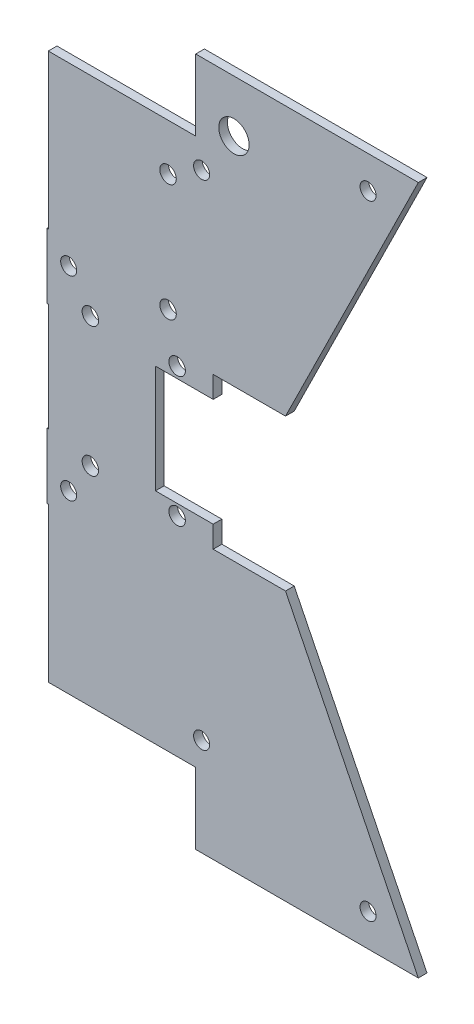
from build123d import *

# Parameters (mm, degrees)
SKETCH1_R           = 2.3495
SKETCH1_R_2         = 4.445
BOSS_EXTRUDE1_DEPTH = 2.54
SKETCH2_R           = 2.413
CUT_EXTRUDE1_DEPTH  = 217.884748371
SKETCH3_W           = 16.89488816
SKETCH3_H           = 31.623
CUT_EXTRUDE2_DEPTH  = 217.884748371
SKETCH4_W           = 12.77569874
SKETCH4_H           = 24.435209008
SKETCH4_W_2         = 40.233428475
SKETCH4_H_2         = 28.333759116
CUT_EXTRUDE3_DEPTH  = 217.884748371
SKETCH5_R           = 2.413
CUT_EXTRUDE4_DEPTH  = 217.884748371


with BuildPart() as part:
    # Sketch1 → Boss-Extrude1 (new body)
    with BuildSketch(Plane.XY):
        Polygon((-2.930050059, -104.509781075), (-3.314938219, -104.509781075), (-3.314938219, -110.859781075), (-3.314938219, -123.559781075), (-2.930050059, -123.559781075), (-2.930050059, -168.708281075), (38.709428475, -168.708281075), (38.709428475, -189.536281075), (105.397061781, -189.536281075), (66.517436481, -110.859781075), (45.329949941, -110.859781075), (45.329949941, -104.509781075), (45.329949941, -72.886781075), (45.329949941, -66.536781075), (66.517436481, -66.536781075), (105.397061781, 12.139718925), (38.709428475, 12.139718925), (38.709428475, -8.688281075), (-2.930050059, -8.688281075), (-2.930050059, -53.836781075), (-3.314938219, -53.836781075), (-3.314938219, -66.536781075), (-3.314938219, -72.886781075), (-2.930050059, -72.886781075), align=None)
        with Locations((90.673911143, 2.614718925)):
            Circle(SKETCH1_R, mode=Mode.SUBTRACT)
        with Locations((41.95655448, -16.435281075)):
            Circle(SKETCH1_R, mode=Mode.SUBTRACT)
        with Locations((3.035061781, -60.186781075)):
            Circle(SKETCH1_R, mode=Mode.SUBTRACT)
        with Locations((3.035061781, -117.209781075)):
            Circle(SKETCH1_R, mode=Mode.SUBTRACT)
        with Locations((41.95655448, -160.961281075)):
            Circle(SKETCH1_R, mode=Mode.SUBTRACT)
        with Locations((90.673911143, -180.011281075)):
            Circle(SKETCH1_R, mode=Mode.SUBTRACT)
        with Locations((51.409428475, -3.100281075)):
            Circle(SKETCH1_R_2, mode=Mode.SUBTRACT)
    extrude(amount=BOSS_EXTRUDE1_DEPTH)

    # Sketch2 → Cut-Extrude1 (cut, through all)
    with BuildSketch(Plane.XY.offset(2.54)):
        with Locations((9.385061781, -69.711781075)):
            Circle(SKETCH2_R)
        with Locations((34.785061781, -69.711781075)):
            Circle(SKETCH2_R)
        with Locations((34.785061781, -107.684781075)):
            Circle(SKETCH2_R)
        with Locations((9.385061781, -107.684781075)):
            Circle(SKETCH2_R)
    extrude(amount=-CUT_EXTRUDE1_DEPTH, mode=Mode.SUBTRACT)

    # Sketch3 → Cut-Extrude2 (cut, through all)
    with BuildSketch(Plane.XY.offset(2.54)):
        with Locations((36.882505861, -88.698281075)):
            Rectangle(SKETCH3_W, SKETCH3_H)
    extrude(amount=-CUT_EXTRUDE2_DEPTH, mode=Mode.SUBTRACT)

    # Sketch4 → Cut-Extrude3 (cut, through all)
    with BuildSketch(Plane.XY.offset(2.54)):
        with Locations((33.845579105, 3.529323429)):
            Rectangle(SKETCH4_W, SKETCH4_H)
        with Locations((20.116714238, -182.875160633)):
            Rectangle(SKETCH4_W_2, SKETCH4_H_2)
    extrude(amount=-CUT_EXTRUDE3_DEPTH, mode=Mode.SUBTRACT)

    # Sketch5 → Cut-Extrude4 (cut, through all)
    with BuildSketch(Plane(origin=(0, 0, 0), x_dir=(-1, 0, 0), z_dir=(0, 0, -1))):
        with Locations((-32.121949941, -22.404281075)):
            Circle(SKETCH5_R)
        with Locations((-32.121949941, -56.694281075)):
            Circle(SKETCH5_R)
    extrude(amount=-CUT_EXTRUDE4_DEPTH, mode=Mode.SUBTRACT)


solid = part.part
